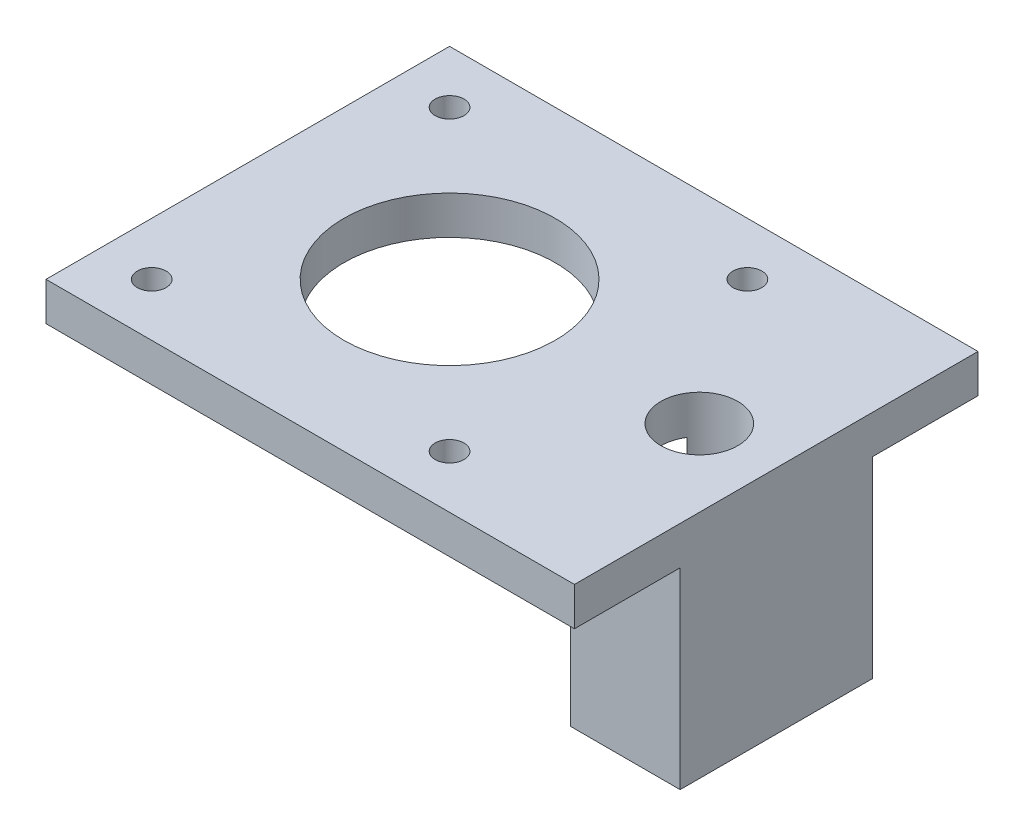
from build123d import *

# Parameters (mm, degrees)
SKETCH1_W           = 55
SKETCH1_H           = 42
SKETCH1_R           = 4
SKETCH1_R_2         = 11
SKETCH1_R_3         = 1.5
BOSS_EXTRUDE1_DEPTH = 4
BOSS_EXTRUDE2_START = 20
BOSS_EXTRUDE2_DEPTH = 20


with BuildPart() as part:
    # Sketch1 → Boss-Extrude1 (new body)
    with BuildSketch(Plane(origin=(0, 0, 0), x_dir=(1, 0, 0), z_dir=(0, 1, 0))):
        with Locations((27.5, 21)):
            Rectangle(SKETCH1_W, SKETCH1_H)
        with Locations((47, 21)):
            Circle(SKETCH1_R, mode=Mode.SUBTRACT)
        with Locations((21, 21)):
            Circle(SKETCH1_R_2, mode=Mode.SUBTRACT)
        with Locations((5.5, 36.5)):
            Circle(SKETCH1_R_3, mode=Mode.SUBTRACT)
        with Locations((36.5, 36.5)):
            Circle(SKETCH1_R_3, mode=Mode.SUBTRACT)
        with Locations((5.5, 5.5)):
            Circle(SKETCH1_R_3, mode=Mode.SUBTRACT)
        with Locations((36.5, 5.5)):
            Circle(SKETCH1_R_3, mode=Mode.SUBTRACT)
    extrude(amount=BOSS_EXTRUDE1_DEPTH)

    # Sketch2 → Boss-Extrude2 (add)
    with BuildSketch(Plane.XZ.offset(BOSS_EXTRUDE2_START)):
        with BuildLine():
            Line((55, -11), (43.6, -11))
            Line((43.6, -11), (43.6, -18.892869249))
            ThreePointArc((43.6, -18.892869249), (51, -21), (43.6, -23.107130751))
            Line((43.6, -23.107130751), (43.6, -31))
            Line((43.6, -31), (55, -31))
            Line((55, -31), (55, -11))
        make_face()
    extrude(amount=-BOSS_EXTRUDE2_DEPTH)


solid = part.part
